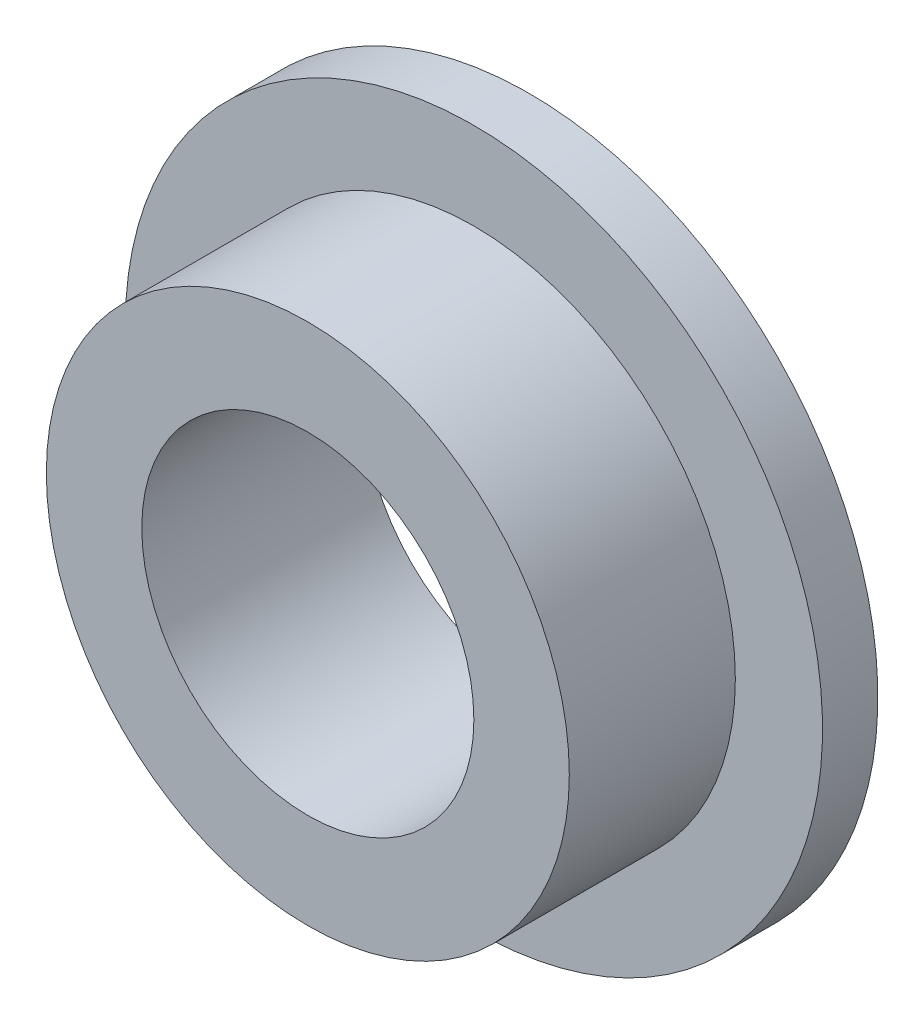
from build123d import *

# Parameters (mm, degrees)
SKETCH1_R           = 15
BOSS_EXTRUDE1_DEPTH = 9.525
SKETCH2_R           = 20
BOSS_EXTRUDE2_DEPTH = 3.175
SKETCH3_R           = 9.525
CUT_EXTRUDE1_DEPTH  = 32.004677067


with BuildPart() as part:
    # Sketch1 → Boss-Extrude1 (new body)
    with BuildSketch(Plane.XY):
        Circle(SKETCH1_R)
    extrude(amount=BOSS_EXTRUDE1_DEPTH)

    # Sketch2 → Boss-Extrude2 (add)
    with BuildSketch(Plane(origin=(0, 0, 0), x_dir=(-1, 0, 0), z_dir=(0, 0, -1))):
        Circle(SKETCH2_R)
    extrude(amount=BOSS_EXTRUDE2_DEPTH)

    # Sketch3 → Cut-Extrude1 (cut, through all)
    with BuildSketch(Plane(origin=(0, 0, -3.175), x_dir=(-1, 0, 0), z_dir=(0, 0, -1))):
        Circle(SKETCH3_R)
    extrude(amount=-CUT_EXTRUDE1_DEPTH, mode=Mode.SUBTRACT)


solid = part.part
